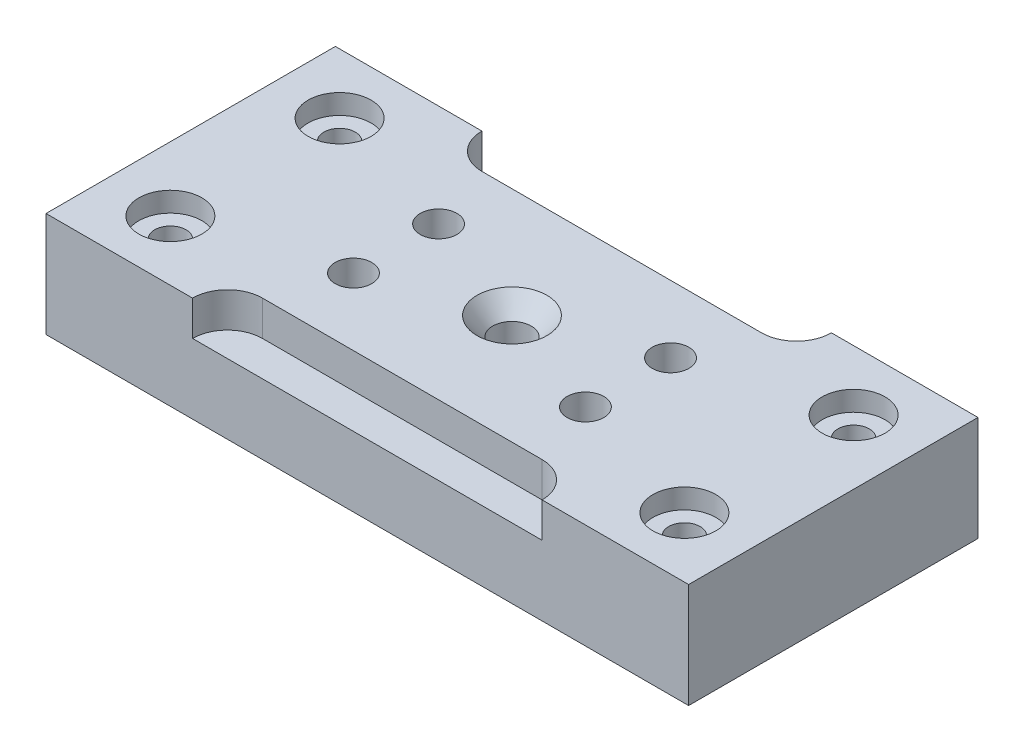
from build123d import *

# Parameters (mm, degrees)
SKETCH1_W                                        = 183.850004878
SKETCH1_H                                        = 82.78473231
BOSS_EXTRUDE1_DEPTH                              = 30
CSK_FOR_M10_FLAT_HEAD_MACHINE_SCREW2_D           = 11
CSK_FOR_M10_FLAT_HEAD_MACHINE_SCREW2_CSINK_D     = 20
CSK_FOR_M10_FLAT_HEAD_MACHINE_SCREW2_CSINK_ANGLE = 80
CBORE_FOR_M8_HEX_HEAD_BOLT1_D                    = 9
CBORE_FOR_M8_HEX_HEAD_BOLT1_CBORE_D              = 18.01
CBORE_FOR_M8_HEX_HEAD_BOLT1_CBORE_DEPTH          = 5.68
MIRROR2_COPY_1_D                                 = 9
MIRROR2_COPY_1_CBORE_D                           = 18.01
MIRROR2_COPY_1_CBORE_DEPTH                       = 5.68
F_20_0MM_START                                   = 20
F_20_0MM_DOWEL_SLOT1_DEPTH                       = 10


# Read off the part's stored shape, not the designer's step: Ø20.0mm Dowel Slot1
with BuildPart() as part:
    # Sketch1 → Boss-Extrude1 (new body)
    with BuildSketch(Plane(origin=(0, 0, 0), x_dir=(1, 0, 0), z_dir=(0, 1, 0))):
        Rectangle(SKETCH1_W, SKETCH1_H)
    extrude(amount=BOSS_EXTRUDE1_DEPTH)

    # CSK for M10 Flat Head Machine Screw2 (through all)
    with Locations(Plane(origin=(0, 30, 0), x_dir=(1, 0, 0), z_dir=(0, 1, 0))):
        with Locations((0, 0)):
            CounterSinkHole(CSK_FOR_M10_FLAT_HEAD_MACHINE_SCREW2_D / 2, CSK_FOR_M10_FLAT_HEAD_MACHINE_SCREW2_CSINK_D / 2, counter_sink_angle=CSK_FOR_M10_FLAT_HEAD_MACHINE_SCREW2_CSINK_ANGLE)

    # CBORE for M8 Hex Head Bolt1 (through all)
    with Locations(Plane(origin=(-73.52781125, 30, -24.202787729), x_dir=(0, 0, 1), z_dir=(0, 1, 0))):
        with Locations((0, 0)):
            cbore_for_m8_hex_head_bolt1 = CounterBoreHole(CBORE_FOR_M8_HEX_HEAD_BOLT1_D / 2, CBORE_FOR_M8_HEX_HEAD_BOLT1_CBORE_D / 2, CBORE_FOR_M8_HEX_HEAD_BOLT1_CBORE_DEPTH)

    # Mirror1: CBORE for M8 Hex Head Bolt1 across plane
    add(cbore_for_m8_hex_head_bolt1.mirror(Plane.XY), mode=Mode.SUBTRACT)

    # Mirror2: CBORE for M8 Hex Head Bolt1 across plane
    add(cbore_for_m8_hex_head_bolt1.mirror(Plane(origin=(0, 0, 0), x_dir=(0, 0, 1), z_dir=(1, 0, 0))), mode=Mode.SUBTRACT)

    # Mirror2 copy 1 (through all)
    with Locations(Plane(origin=(73.52781125, 30, 24.202787729), x_dir=(0, 0, -1), z_dir=(0, 1, 0))):
        with Locations((0, 0)):
            CounterBoreHole(MIRROR2_COPY_1_D / 2, MIRROR2_COPY_1_CBORE_D / 2, MIRROR2_COPY_1_CBORE_DEPTH)

    # Ø20.0mm Dowel Slot1 outline → Ø20.0mm Dowel Slot1 (cut)
    with BuildSketch(Plane(origin=(0, 0, 0), x_dir=(1, 0, 0), z_dir=(0, 1, 0)).offset(F_20_0MM_START)):
        with BuildLine():
            Line((-50, -41.392366155), (50, -41.392366155))
            ThreePointArc((50, -41.392366155), (47.071067812, -34.321298343), (40, -31.392366155))
            Line((40, -31.392366155), (-40, -31.392366155))
            ThreePointArc((-40, -31.392366155), (-47.071067812, -34.321298343), (-50, -41.392366155))
        make_face()
    f_20_0mm_dowel_slot1 = extrude(amount=F_20_0MM_DOWEL_SLOT1_DEPTH, mode=Mode.SUBTRACT)

    # Mirror3: Ø20.0mm Dowel Slot1 across plane
    add(f_20_0mm_dowel_slot1.mirror(Plane.XY), mode=Mode.SUBTRACT)

    # Sketch20 → M12x1.5 Tapped Hole1 (revolve, cut)
    with BuildSketch(Plane(origin=(-33.179705033, 30, -12.1730736), x_dir=(0, 0, 1), z_dir=(1, 0, 0))):
        Polygon((0, 0), (0, 18.15451825), (5.25, 15), (5.25, 0), align=None)
    m12x1_5_tapped_hole1 = revolve(axis=Axis((-33.179705033, 36.35, -12.1730736), (0, -1, 0)), mode=Mode.SUBTRACT)

    # Mirror4: M12x1.5 Tapped Hole1 across plane
    add(m12x1_5_tapped_hole1.mirror(Plane.XY), mode=Mode.SUBTRACT)

    # Mirror5: M12x1.5 Tapped Hole1 across plane
    add(m12x1_5_tapped_hole1.mirror(Plane(origin=(0, 0, 0), x_dir=(0, 0, 1), z_dir=(1, 0, 0))), mode=Mode.SUBTRACT)

    # Mirror5 copy 1 sketch → Mirror5 copy 1 (revolve, cut)
    with BuildSketch(Plane(origin=(33.179705033, 30, 12.1730736), x_dir=(0, 0, -1), z_dir=(-1, 0, 0))):
        Polygon((0, 0), (0, 18.15451825), (5.25, 15), (5.25, 0), align=None)
    revolve(axis=Axis((33.179705033, 36.35, 12.1730736), (0, -1, 0)), mode=Mode.SUBTRACT)


solid = part.part
